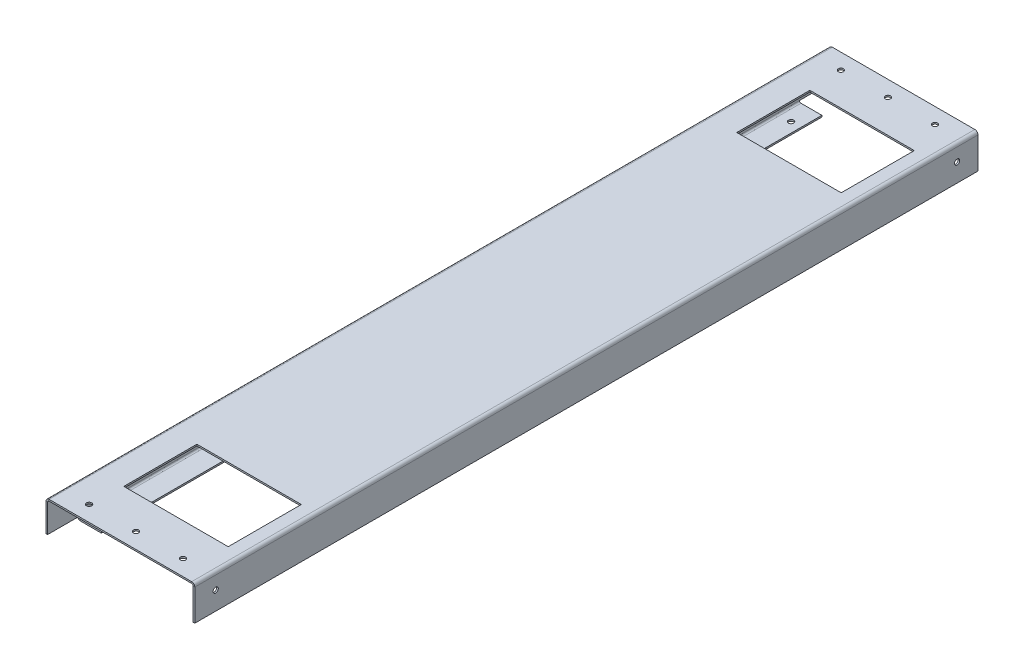
from build123d import *

# Parameters (mm, degrees)
SM_BASE_FLANGE_1_DEPTH = 375
SKETCH_6_R             = 2.5
CUT_EXTRUDE_1_DEPTH    = 10
SKETCH_7_R             = 2.5
SKETCH_7_W             = 20
SKETCH_7_H             = 30
SKETCH_7_W_2           = 3
CUT_EXTRUDE_2_DEPTH    = 3
SKETCH_8_R             = 2.5
CUT_EXTRUDE_3_DEPTH    = 1.5
SKETCH_10_W            = 100
SKETCH_10_H            = 70
CUT_EXTRUDE_5_DEPTH    = 1.5


# Sheet-metal steps are written as plain solids
with BuildPart() as part:
    # Sketch 1 → Базовая кромка1 (new, symmetric)
    with BuildSketch(Plane.XY):
        with BuildLine():
            Line((-25.25, -33), (-68.25, -33))
            ThreePointArc((-68.25, -33), (-70.371320344, -32.121320344), (-71.25, -30))
            Line((-71.25, -30), (-71.25, -3))
            ThreePointArc((-71.25, -3), (-70.371320344, -0.878679656), (-68.25, 0))
            Line((-68.25, 0), (68.25, 0))
            ThreePointArc((68.25, 0), (70.371320344, -0.878679656), (71.25, -3))
            Line((71.25, -3), (71.25, -33))
            Line((71.25, -33), (69.75, -33))
            Line((69.75, -33), (69.75, -3))
            ThreePointArc((69.75, -3), (69.310660172, -1.939339828), (68.25, -1.5))
            Line((68.25, -1.5), (-68.25, -1.5))
            ThreePointArc((-68.25, -1.5), (-69.310660172, -1.939339828), (-69.75, -3))
            Line((-69.75, -3), (-69.75, -30))
            ThreePointArc((-69.75, -30), (-69.310660172, -31.060660172), (-68.25, -31.5))
            Line((-68.25, -31.5), (-25.25, -31.5))
            Line((-25.25, -31.5), (-25.25, -33))
        make_face()
    extrude(amount=SM_BASE_FLANGE_1_DEPTH, both=True)

    # Эскиз6 → Вырез-Вытянуть1 (cut)
    with BuildSketch(Plane(origin=(71.25, 0, 0), x_dir=(0, 0, -1), z_dir=(1, 0, 0))):
        with Locations((-355, -15.5)):
            Circle(SKETCH_6_R)
        with Locations((355, -15.5)):
            Circle(SKETCH_6_R)
    extrude(amount=-CUT_EXTRUDE_1_DEPTH, mode=Mode.SUBTRACT)

    # Эскиз7 → Вырез-Вытянуть2 (cut)
    with BuildSketch(Plane.XZ.offset(33)):
        with Locations((-57.75, -325)):
            Circle(SKETCH_7_R)
        with Locations((-58.25, -360)):
            Rectangle(SKETCH_7_W, SKETCH_7_H)
        Polygon((-48.25, -375), (-25.25, -375), (-25.25, 375), (-48.25, 375), (-48.25, 345), (-48.25, -345), align=None)
        with Locations((-69.75, -360)):
            Rectangle(SKETCH_7_W_2, SKETCH_7_H)
        with Locations((-58.25, 360)):
            Rectangle(SKETCH_7_W, SKETCH_7_H)
        with Locations((-69.75, 360)):
            Rectangle(SKETCH_7_W_2, SKETCH_7_H)
        with Locations((-57.75, 325)):
            Circle(SKETCH_7_R)
    extrude(amount=-CUT_EXTRUDE_2_DEPTH, mode=Mode.SUBTRACT)

    # Эскиз8 → Вырез-Вытянуть3 (cut)
    with BuildSketch(Plane.XZ.offset(1.5)):
        with Locations((-45, -360)):
            Circle(SKETCH_8_R)
        with Locations((0, -360)):
            Circle(SKETCH_8_R)
        with Locations((45, -360)):
            Circle(SKETCH_8_R)
        with Locations(Location((45, 360, 0), (0, 0, 180))):
            Circle(SKETCH_8_R)
        with Locations(Location((0, 360, 0), (0, 0, 180))):
            Circle(SKETCH_8_R)
        with Locations(Location((-45, 360, 0), (0, 0, 180))):
            Circle(SKETCH_8_R)
    extrude(amount=-CUT_EXTRUDE_3_DEPTH, mode=Mode.SUBTRACT)

    # Эскиз10 → Вырез-Вытянуть5 (cut)
    with BuildSketch(Plane(origin=(0, 0, 0), x_dir=(1, 0, 0), z_dir=(0, 1, 0))):
        with Locations((6.75, 293.5)):
            Rectangle(SKETCH_10_W, SKETCH_10_H)
        with Locations((6.75, -293.5)):
            Rectangle(SKETCH_10_W, SKETCH_10_H)
    extrude(amount=-CUT_EXTRUDE_5_DEPTH, mode=Mode.SUBTRACT)


solid = part.part
